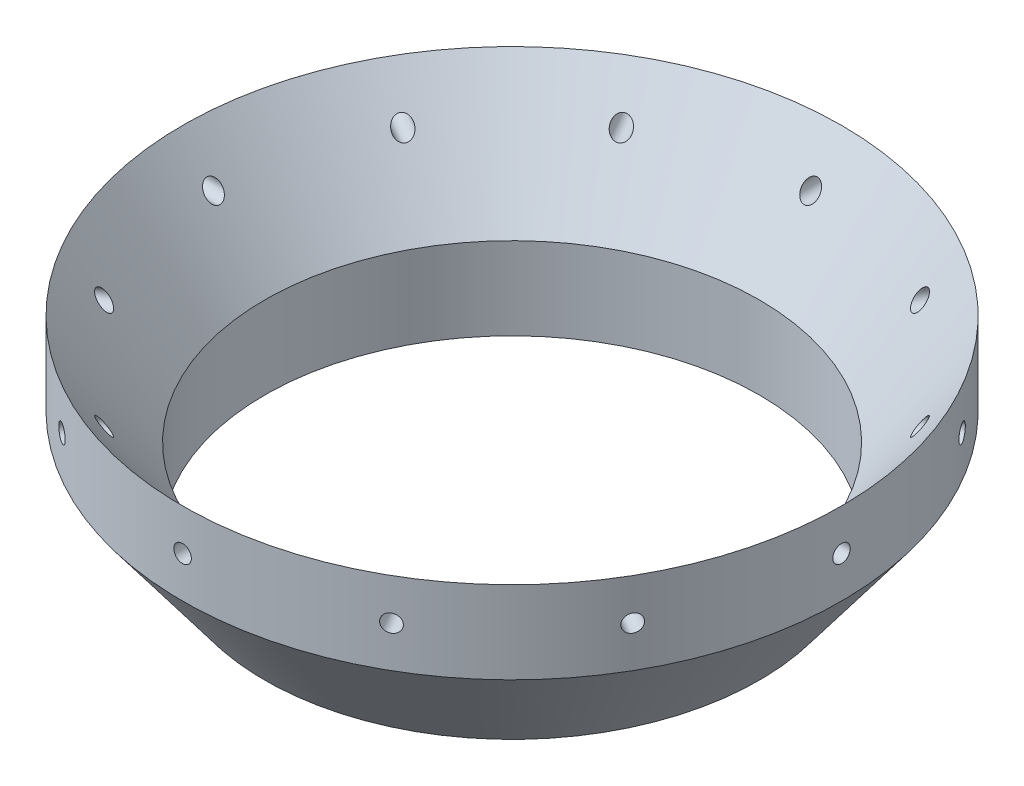
from build123d import *

# Parameters (mm, degrees)
SKETCH2_R          = 2.0193
CUT_EXTRUDE1_DEPTH = 267.514272105
CIRPATTERN1_COUNT  = 12


with BuildPart() as part:
    # Sketch1 → Revolve1 (revolve)
    with BuildSketch(Plane.XY):
        Polygon((-57.15, 199.305978871), (-57.15, 218.355978871), (-76.2, 243.755978871), (-76.2, 224.705978871), align=None)
    revolve(axis=Axis((0, 0, 0), (0, 1, 0)))

    # Sketch2 → Cut-Extrude1 (cut, through all)
    with BuildSketch(Plane.XY):
        with Locations((0, 234.230978871)):
            Circle(SKETCH2_R)
    cut_extrude1 = extrude(amount=-CUT_EXTRUDE1_DEPTH, mode=Mode.SUBTRACT)

    # CirPattern1: Cut-Extrude1 ×12 about axis
    cirpattern1_axis = Axis((0, 235.80346447, 0), (0, -1, 0))
    for i in range(1, CIRPATTERN1_COUNT):
        add(cut_extrude1.rotate(cirpattern1_axis, i * 360 / CIRPATTERN1_COUNT), mode=Mode.SUBTRACT)


solid = part.part
